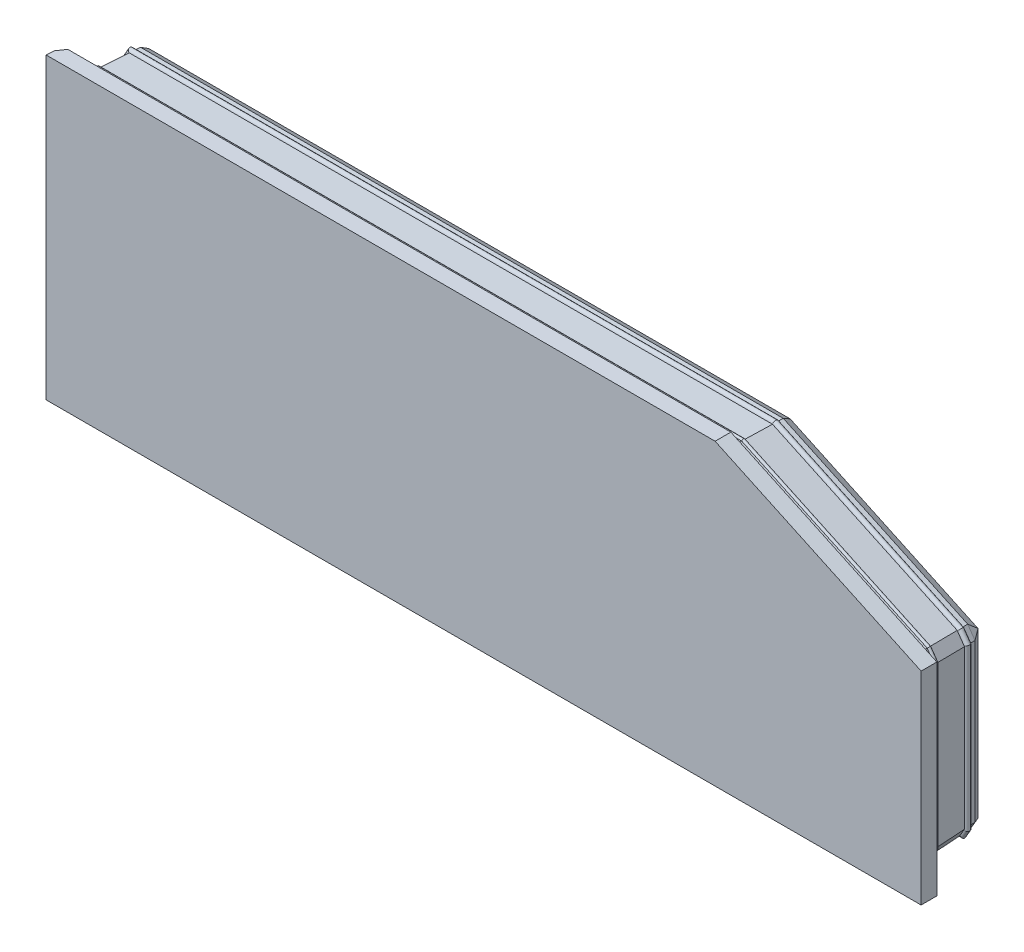
from build123d import *

# Parameters (mm, degrees)
BOSS_EXTRUDE1_DEPTH = 1.95
EXTRUDE_THIN1_DEPTH = 8
EXTRUDE_THIN1_DRAFT = 2
CUT_EXTRUDE1_DEPTH  = 115.977189042
FILLET1_R           = 2
SWEEP4_PROFILE_R    = 0.35
SWEEP5_PROFILE_R    = 0.2


with BuildPart() as part:
    # Sketch1 → Boss-Extrude1 (new body)
    with BuildSketch(Plane.XY):
        Polygon((0, 0), (0, 37.02), (83.03, 37.02), (108.56, 25.11), (108.56, 0), align=None)
    extrude(amount=BOSS_EXTRUDE1_DEPTH)


with BuildPart() as extrude_thin1_tool:
    # Sketch2 → Extrude-Thin1 (with draft: the straight prism first)
    with BuildSketch(Plane(origin=(0, 0, 0), x_dir=(-1, 0, 0), z_dir=(0, 0, -1))):
        Polygon((-106.53, 2.03), (-2.03, 2.03), (-2.03, 34.99), (-82.579782869, 34.99), (-106.53, 23.816984488), align=None)
        Polygon((-104.53, 4.03), (-4.03, 4.03), (-4.03, 32.99), (-82.136219193, 32.99), (-104.53, 22.543077579), align=None, mode=Mode.SUBTRACT)
    extrude(amount=EXTRUDE_THIN1_DEPTH)
    # Extrude-Thin1: the draft: its side faces are tilted about the plane it starts from
    extrude_thin1_sides = [extrude_thin1_tool.faces().sort_by_distance(p)[0] for p in [
        (54.28, 2.03, -4),
        (2.03, 18.51, -4),
        (42.304891435, 34.99, -4),
        (94.554891435, 29.403492244, -4),
        (106.53, 12.923492244, -4),
        (104.53, 13.286538789, -4),
        (93.333109597, 27.766538789, -4),
        (43.083109597, 32.99, -4),
        (4.03, 18.51, -4),
        (54.28, 4.03, -4),
    ]]
    draft(extrude_thin1_sides, Plane(origin=(0, 0, 0), x_dir=(-1, 0, 0), z_dir=(0, 0, -1)), EXTRUDE_THIN1_DRAFT)


with BuildPart() as part_1:
    add(part.part)

    # Extrude-Thin1: add extrude_thin1_tool
    add(extrude_thin1_tool.part)

    # Sketch3 → Cut-Extrude1 (cut, through all)
    with BuildSketch(Plane(origin=(0, 37.02, 0), x_dir=(1, 0, 0), z_dir=(0, 1, 0))):
        Polygon((0, -1.95), (0.1, -1.95), (0.25, 0), (0, 0), align=None)
    extrude(amount=-CUT_EXTRUDE1_DEPTH, mode=Mode.SUBTRACT)

    # Fillet1
    fillet1_edges = [part_1.edges().sort_by_distance(p)[0] for p in [
        (104.53, 13.286538789, 0),
        (54.28, 4.03, 0),
        (4.03, 18.51, 0),
        (43.083109597, 32.99, 0),
        (93.333109597, 27.766538789, 0),
        (104.669683078, 3.890316922, -4),
        (3.890316922, 3.890316922, -4),
        (3.890316922, 33.129683078, -4),
        (82.167198363, 33.129683078, -4),
        (104.669683078, 22.632049198, -4),
    ]]
    fillet(fillet1_edges, radius=FILLET1_R)

    # Chamfer1
    # the kernel refuses this chamfer: 1, 0.87289825, 0.605967864, 0.589589202, 0.577756975 mm, written as the material it takes off along each edge
    with BuildSketch(Plane(origin=(105.775216634, 23.378600332, -7.333739449), x_dir=(-0.21304506320944425, 0.6200388912519721, 0.7550917655339046), z_dir=(0.7969229766736515, 0.5573974303176954, -0.23285590807371978))) as chamfer1_piece_1:
        Polygon((-0.550130529, -0.409319885), (0.773405063, -0.409319885), (-0.223274534, 0.818639769), align=None)
    extrude(amount=0.747100973, mode=Mode.SUBTRACT)
    with BuildSketch(Plane(origin=(105.884667536, 2.816165826, -7.333739449), x_dir=(0.0393259866782338, -0.5295093368050788, 0.8473920751387924), z_dir=(0.8165501905229234, -0.47176756829689104, -0.3326877633160196))) as chamfer1_piece_2:
        Polygon((-0.617215932, 0.346134252), (0.56215647, 0.346134252), (0.055059462, -0.692268505), align=None)
    extrude(amount=0.835536063, mode=Mode.SUBTRACT)
    with BuildSketch(Plane(origin=(2.816165826, 2.675332464, -7.333739449), x_dir=(0.3040517824810945, -0.5048305049346018, 0.8078976883600696), z_dir=(-0.471767568296886, -0.8165501905229261, -0.33268776331602)), Plane(origin=(2.675332464, 34.203834174, -7.333739449), x_dir=(-0.5048305049346006, -0.30405178248109604, 0.8078976883600698), z_dir=(-0.8165501905229273, 0.47176756829688477, -0.3326877633160189))) as chamfer1_piece_3:
        Polygon((-0.625989713, -0.33000198), (0.611036759, -0.33000198), (0.014952954, 0.660003959), align=None)
    extrude(amount=0.835536063, mode=Mode.SUBTRACT)
    with BuildSketch(Plane(origin=(106.250633844, 26.226127004, -8), x_dir=(-1, 0, 0), z_dir=(0, -1, 0))) as chamfer1_piece_4:
        with BuildLine():
            Line((0.610785972, 0.033921924), (-0.056096267, -1.033312751))
            Line((-0.056096267, -1.033312751), (-0.076084084, -1.032614761))
            ThreePointArc((-0.076084084, -1.032614761), (-0.038042042, -0.51630738), (-0.019987817, 0.00069799))
            Line((-0.019987817, 0.00069799), (0, 0.02))
            ThreePointArc((0, 0.02), (0.305392986, 0.02), (0.610785972, 0.053921924))
            Line((0.610785972, 0.053921924), (0.610785972, 0.033921924))
        make_face()
    extrude(amount=26.503846603, mode=Mode.SUBTRACT)
    with BuildSketch(Plane(origin=(108.837719599, 2.309366156, -8), x_dir=(0, 1, 0), z_dir=(-1, 0, 0))) as chamfer1_piece_5:
        with BuildLine():
            Line((0.610785972, 0.033921924), (-0.056096267, -1.033312751))
            Line((-0.056096267, -1.033312751), (-0.076084084, -1.032614761))
            ThreePointArc((-0.076084084, -1.032614761), (-0.038042042, -0.51630738), (-0.019987817, 0.00069799))
            Line((-0.019987817, 0.00069799), (0, 0.02))
            ThreePointArc((0, 0.02), (0.305392986, 0.02), (0.610785972, 0.053921924))
            Line((0.610785972, 0.053921924), (0.610785972, 0.033921924))
        make_face()
    extrude(amount=109.115439197, mode=Mode.SUBTRACT)
    with BuildSketch(Plane(origin=(2.309366156, -0.277719599, -8), x_dir=(1, 0, 0), z_dir=(0, 1, 0))) as chamfer1_piece_6:
        with BuildLine():
            Line((0.610785972, 0.033921924), (-0.056096267, -1.033312751))
            Line((-0.056096267, -1.033312751), (-0.076084084, -1.032614761))
            ThreePointArc((-0.076084084, -1.032614761), (-0.038042042, -0.51630738), (-0.019987817, 0.00069799))
            Line((-0.019987817, 0.00069799), (0, 0.02))
            ThreePointArc((0, 0.02), (0.305392986, 0.02), (0.610785972, 0.053921924))
            Line((0.610785972, 0.053921924), (0.610785972, 0.033921924))
        make_face()
    extrude(amount=37.575439197, mode=Mode.SUBTRACT)
    with BuildSketch(Plane(origin=(-0.277719599, 34.710633844, -8), x_dir=(0, -1, 0), z_dir=(1, 0, 0))) as chamfer1_piece_7:
        with BuildLine():
            Line((0.610785972, 0.033921924), (-0.056096267, -1.033312751))
            Line((-0.056096267, -1.033312751), (-0.076084084, -1.032614761))
            ThreePointArc((-0.076084084, -1.032614761), (-0.038042042, -0.51630738), (-0.019987817, 0.00069799))
            Line((-0.019987817, 0.00069799), (0, 0.02))
            ThreePointArc((0, 0.02), (0.305392986, 0.02), (0.610785972, 0.053921924))
            Line((0.610785972, 0.053921924), (0.610785972, 0.033921924))
        make_face()
    extrude(amount=85.382629883, mode=Mode.SUBTRACT)
    with BuildSketch(Plane(origin=(80.173310289, 35.804373155, -8), x_dir=(-0.4227688659566774, -0.9062375439020968, 0), z_dir=(0.9062375439020969, -0.4227688659566774, 0))) as chamfer1_piece_8:
        with BuildLine():
            Line((0.610785972, 0.033921924), (-0.056096267, -1.033312751))
            Line((-0.056096267, -1.033312751), (-0.076084084, -1.032614761))
            ThreePointArc((-0.076084084, -1.032614761), (-0.038042042, -0.51630738), (-0.019987817, 0.00069799))
            Line((-0.019987817, 0.00069799), (0, 0.02))
            ThreePointArc((0, 0.02), (0.305392986, 0.02), (0.610785972, 0.053921924))
            Line((0.610785972, 0.053921924), (0.610785972, 0.033921924))
        make_face()
    extrude(amount=31.362458978, mode=Mode.SUBTRACT)
    with BuildSketch(Plane(origin=(106.620265691, 23.874479532, 2.584871201), x_dir=(-0.9056858205769407, 0.4233673296311047, 0.02221032658249641), z_dir=(-0.034890877204488725, -0.022223864760439818, -0.9991439968908441))) as chamfer1_piece_9_section:
        with BuildLine():
            Line((1.034641016, 0.02), (-0.404288913, -0.810766582))
            Line((-0.404288913, -0.810766582), (-0.422407098, -0.802297144))
            ThreePointArc((-0.422407098, -0.802297144), (-0.209884464, -0.401765185), (-0.018118185, 0.008469438))
            Line((-0.018118185, 0.008469438), (0, 0.02))
            ThreePointArc((0, 0.02), (0.517320508, 0.02), (1.034641016, 0.04))
            Line((1.034641016, 0.04), (1.034641016, 0.02))
        make_face()
    chamfer1_piece_9 = extrude(amount=13.181025401, mode=Mode.PRIVATE)
    chamfer1_piece_9 = split(chamfer1_piece_9, bisect_by=Plane(origin=(106.620265691, 23.874479532, 0), z_dir=(0, 0, -1)), keep=Keep.TOP, mode=Mode.PRIVATE)
    add(chamfer1_piece_9, mode=Mode.SUBTRACT)
    with BuildSketch(Plane(origin=(106.620233057, 1.939766943, 2.583936666), x_dir=(-0.9993915682994698, -0.001217233815563483, 0.03485701584709124), z_dir=(-0.03487826274237467, 0.03487826274237467, -0.9987827659587183))) as chamfer1_piece_10_section:
        with BuildLine():
            Line((0.597799152, -0.034616631), (-0.021260152, 1.034615889))
            Line((-0.021260152, 1.034615889), (-0.041260137, 1.03459153))
            ThreePointArc((-0.041260137, 1.03459153), (-0.020630069, 0.517295765), (-0.019999985, -2.4359e-05))
            Line((-0.019999985, -2.4359e-05), (0, -0.02))
            ThreePointArc((0, -0.02), (0.298899576, -0.02), (0.597799152, -0.054616631))
            Line((0.597799152, -0.054616631), (0.597799152, -0.034616631))
        make_face()
    chamfer1_piece_10 = extrude(amount=13.183921249, mode=Mode.PRIVATE)
    chamfer1_piece_10 = split(chamfer1_piece_10, bisect_by=Plane(origin=(106.620233057, 1.939766943, 0), z_dir=(0, 0, -1)), keep=Keep.TOP, mode=Mode.PRIVATE)
    add(chamfer1_piece_10, mode=Mode.SUBTRACT)
    with BuildSketch(Plane(origin=(1.939766943, 1.939766943, 2.583936666), x_dir=(0.9993915682994698, -0.0012172338155664961, 0.03485701584709113), z_dir=(0.03487826274237467, 0.03487826274237467, -0.9987827659587183))) as chamfer1_piece_11_section:
        with BuildLine():
            Line((1.034641016, 0.02), (-0.03534471, -0.597756547))
            Line((-0.03534471, -0.597756547), (-0.055344695, -0.597732187))
            ThreePointArc((-0.055344695, -0.597732187), (-0.020364037, -0.298874995), (-0.019999985, 2.4359e-05))
            Line((-0.019999985, 2.4359e-05), (0, 0.02))
            ThreePointArc((0, 0.02), (0.517320508, 0.02), (1.034641016, 0.04))
            Line((1.034641016, 0.04), (1.034641016, 0.02))
        make_face()
    chamfer1_piece_11 = extrude(amount=13.183921249, mode=Mode.PRIVATE)
    chamfer1_piece_11 = split(chamfer1_piece_11, bisect_by=Plane(origin=(1.939766943, 1.939766943, 0), z_dir=(0, 0, -1)), keep=Keep.TOP, mode=Mode.PRIVATE)
    add(chamfer1_piece_11, mode=Mode.SUBTRACT)
    with BuildSketch(Plane(origin=(1.939766943, 35.080233057, 2.583936666), x_dir=(-0.001217233815566496, -0.9993915682994698, 0.03485701584709113), z_dir=(0.03487826274237467, -0.03487826274237467, -0.9987827659587183))) as chamfer1_piece_12_section:
        with BuildLine():
            Line((1.034641016, 0.02), (-0.03534471, -0.597756547))
            Line((-0.03534471, -0.597756547), (-0.055344695, -0.597732187))
            ThreePointArc((-0.055344695, -0.597732187), (-0.020364037, -0.298874995), (-0.019999985, 2.4359e-05))
            Line((-0.019999985, 2.4359e-05), (0, 0.02))
            ThreePointArc((0, 0.02), (0.517320508, 0.02), (1.034641016, 0.04))
            Line((1.034641016, 0.04), (1.034641016, 0.02))
        make_face()
    chamfer1_piece_12 = extrude(amount=13.183921249, mode=Mode.PRIVATE)
    chamfer1_piece_12 = split(chamfer1_piece_12, bisect_by=Plane(origin=(1.939766943, 35.080233057, 0), z_dir=(0, 0, -1)), keep=Keep.TOP, mode=Mode.PRIVATE)
    add(chamfer1_piece_12, mode=Mode.SUBTRACT)
    with BuildSketch(Plane(origin=(0.25, 39.607085755, 0), x_dir=(1, 0, 0), z_dir=(0, -1, 0))) as chamfer1_piece_13:
        with BuildLine():
            Line((0.628565799, -0.033005051), (-0.099294433, 1.030059536))
            Line((-0.099294433, 1.030059536), (-0.119235523, 1.028525606))
            ThreePointArc((-0.119235523, 1.028525606), (-0.059617761, 0.514262803), (-0.01994109, -0.00153393))
            Line((-0.01994109, -0.00153393), (0, -0.02))
            ThreePointArc((0, -0.02), (0.314282899, -0.02), (0.628565799, -0.053005051))
            Line((0.628565799, -0.053005051), (0.628565799, -0.033005051))
        make_face()
    extrude(amount=42.194171509, mode=Mode.SUBTRACT)

    # Sweep4: sweep along a path in Sketch13
    with BuildLine(Plane(origin=(0, 0, -6), x_dir=(-1, 0, 0), z_dir=(0, 0, -1))) as sweep4_path:
        Line((-2.752395457, 34.74), (-82.52433741, 34.74))
        Line((-82.52433741, 34.74), (-105.457097335, 24.041638437))
        Line((-105.457097335, 24.041638437), (-106.28, 22.865116971))
        Line((-106.28, 22.865116971), (-106.28, 3.097636961))
        Line((-106.28, 3.097636961), (-105.807604543, 2.28))
        Line((-105.807604543, 2.28), (-3.097636961, 2.28))
        Line((-3.097636961, 2.28), (-2.28, 2.752395457))
        Line((-2.28, 2.752395457), (-2.28, 33.922363039))
        Line((-2.28, 33.922363039), (-2.752395457, 34.74))
    # Sweep4 profile (on start of the path) → Sweep4 (sweep)
    with BuildSketch(Plane(origin=(2.752395457, 34.74, -6), x_dir=(0, 1, 0), z_dir=(1, 0, 0))):
        Circle(SWEEP4_PROFILE_R)
    sweep(path=sweep4_path.line, transition=Transition.RIGHT)

    # Sweep5: sweep along a path in Sketch37
    with BuildLine(Plane(origin=(0, 0, -2), x_dir=(-1, 0, 0), z_dir=(0, 0, -1))) as sweep5_path:
        Line((-3.057420066, 2.13), (-2.13, 2.665823412))
        Line((-2.13, 2.665823412), (-2.13, 33.962579934))
        Line((-2.13, 33.962579934), (-2.665823412, 34.89))
        Line((-2.665823412, 34.89), (-82.557604685, 34.89))
        Line((-82.557604685, 34.89), (-105.556962081, 24.160570052))
        Line((-105.556962081, 24.160570052), (-106.43, 22.912369146))
        Line((-106.43, 22.912369146), (-106.43, 3.057420066))
        Line((-106.43, 3.057420066), (-105.894176588, 2.13))
        Line((-105.894176588, 2.13), (-3.057420066, 2.13))
    # Sweep5 profile (on start of the path) → Sweep5 (sweep)
    with BuildSketch(Plane(origin=(3.057420066, 2.13, -2), x_dir=(-0.5002640936209776, -0.8658728755617546, 0), z_dir=(-0.8658728755617546, 0.5002640936209776, 0))):
        Circle(SWEEP5_PROFILE_R)
    sweep(path=sweep5_path.line, transition=Transition.RIGHT)


solid = part_1.part
